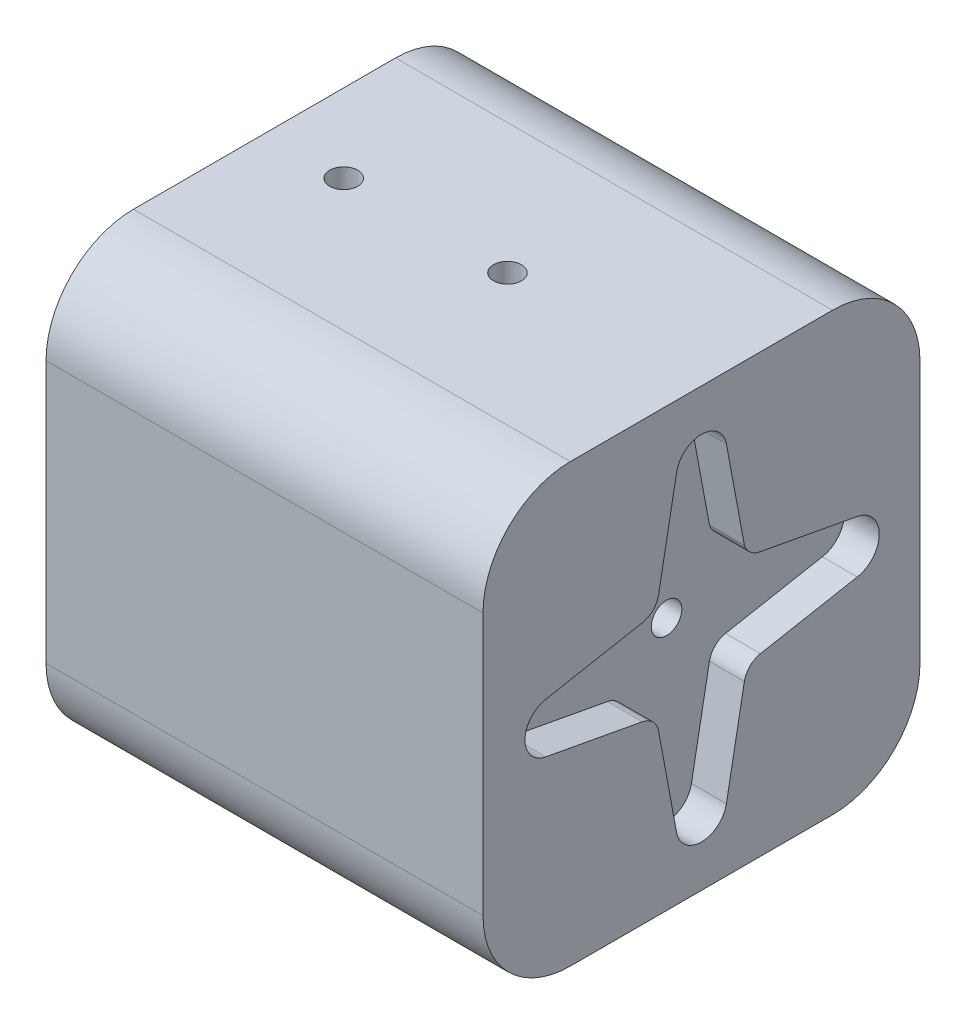
from build123d import *

# Parameters (mm, degrees)
ESQUISSE1_W             = 50
ESQUISSE1_H             = 50
BOSS_EXTRU_1_DEPTH      = 50
ESQUISSE2_R             = 6
ENL_V_MAT_EXTRU_1_DEPTH = 40
CONG_1_R                = 10
ESQUISSE3_R             = 1.6
ENL_V_MAT_EXTRU_2_DEPTH = 21
ENL_V_MAT_EXTRU_3_DEPTH = 4
ESQUISSE5_R             = 1.75
ENL_V_MAT_EXTRU_4_DEPTH = 90
ESQUISSE6_R             = 1.6
ENL_V_MAT_EXTRU_5_DEPTH = 20


with BuildPart() as part:
    # Esquisse1 → Boss.-Extru.1 (new body)
    with BuildSketch(Plane.XY):
        with Locations((25, 25)):
            Rectangle(ESQUISSE1_W, ESQUISSE1_H)
    extrude(amount=BOSS_EXTRU_1_DEPTH)

    # Esquisse2 → Enlèv. mat.-Extru.1 (cut)
    with BuildSketch(Plane.ZY):
        with Locations((24.976890997, 24.856256207)):
            Circle(ESQUISSE2_R)
    extrude(amount=-ENL_V_MAT_EXTRU_1_DEPTH, mode=Mode.SUBTRACT)

    # Congé1
    cong_1_edges = [part.edges().sort_by_distance(p)[0] for p in [
        (25, 0, 50),
        (25, 50, 0),
        (25, 50, 50),
        (25, 0, 0),
    ]]
    fillet(cong_1_edges, radius=CONG_1_R)

    # Esquisse3 → Enlèv. mat.-Extru.2 (cut)
    with BuildSketch(Plane(origin=(0, 50, 0), x_dir=(1, 0, 0), z_dir=(0, 1, 0))):
        with Locations((8.958242403, -24.894645172)):
            Circle(ESQUISSE3_R)
        with Locations((27.695396355, -24.894645172)):
            Circle(ESQUISSE3_R)
    extrude(amount=-ENL_V_MAT_EXTRU_2_DEPTH, mode=Mode.SUBTRACT)

    # Esquisse4 → Enlèv. mat.-Extru.3 (cut)
    with BuildSketch(Plane(origin=(50, 0, 0), x_dir=(0, 0, -1), z_dir=(1, 0, 0))):
        with BuildLine():
            Line((-7.144655121, 28.135805281), (-18.224176514, 30.192846764))
            ThreePointArc((-18.224176514, 30.192846764), (-19.380476075, 30.704407729), (-20.091653936, 31.749849906))
            Line((-20.091653936, 31.749849906), (-22.148695418, 42.829371299))
            ThreePointArc((-22.148695418, 42.829371299), (-24.9999654, 45.1999956), (-27.851235382, 42.829371299))
            Line((-27.851235382, 42.829371299), (-29.908276864, 31.749849906))
            ThreePointArc((-29.908276864, 31.749849906), (-30.543285097, 30.543354297), (-31.749780706, 29.908346064))
            Line((-31.749780706, 29.908346064), (-42.829302099, 27.851304582))
            ThreePointArc((-42.829302099, 27.851304582), (-45.1999264, 25.0000346), (-42.829302099, 22.148764618))
            Line((-42.829302099, 22.148764618), (-31.749780706, 20.091723136))
            ThreePointArc((-31.749780706, 20.091723136), (-30.543285097, 19.456714903), (-29.908276864, 18.250219294))
            Line((-29.908276864, 18.250219294), (-27.851235382, 7.170697901))
            ThreePointArc((-27.851235382, 7.170697901), (-24.9999654, 4.8000736), (-22.148695418, 7.170697901))
            Line((-22.148695418, 7.170697901), (-20.091653936, 18.250219294))
            ThreePointArc((-20.091653936, 18.250219294), (-19.456645703, 19.456714903), (-18.250150094, 20.091723136))
            Line((-18.250150094, 20.091723136), (-7.170628701, 22.148764618))
            ThreePointArc((-7.170628701, 22.148764618), (-4.657744871, 25.131439646), (-7.144655121, 28.135805281))
        make_face()
    extrude(amount=-ENL_V_MAT_EXTRU_3_DEPTH, mode=Mode.SUBTRACT)

    # Esquisse5 → Enlèv. mat.-Extru.4 (cut)
    with BuildSketch(Plane(origin=(46, 0, 0), x_dir=(0, 0, -1), z_dir=(1, 0, 0))):
        with Locations((-24.9999654, 25.0000346)):
            Circle(ESQUISSE5_R)
    extrude(amount=-ENL_V_MAT_EXTRU_4_DEPTH, mode=Mode.SUBTRACT)

    # Esquisse6 → Enlèv. mat.-Extru.5 (cut)
    with BuildSketch(Plane(origin=(0, 0, 0), x_dir=(-1, 0, 0), z_dir=(0, 0, -1))):
        with Locations((-20.420656161, 25)):
            Circle(ESQUISSE6_R)
    extrude(amount=-ENL_V_MAT_EXTRU_5_DEPTH, mode=Mode.SUBTRACT)


solid = part.part
